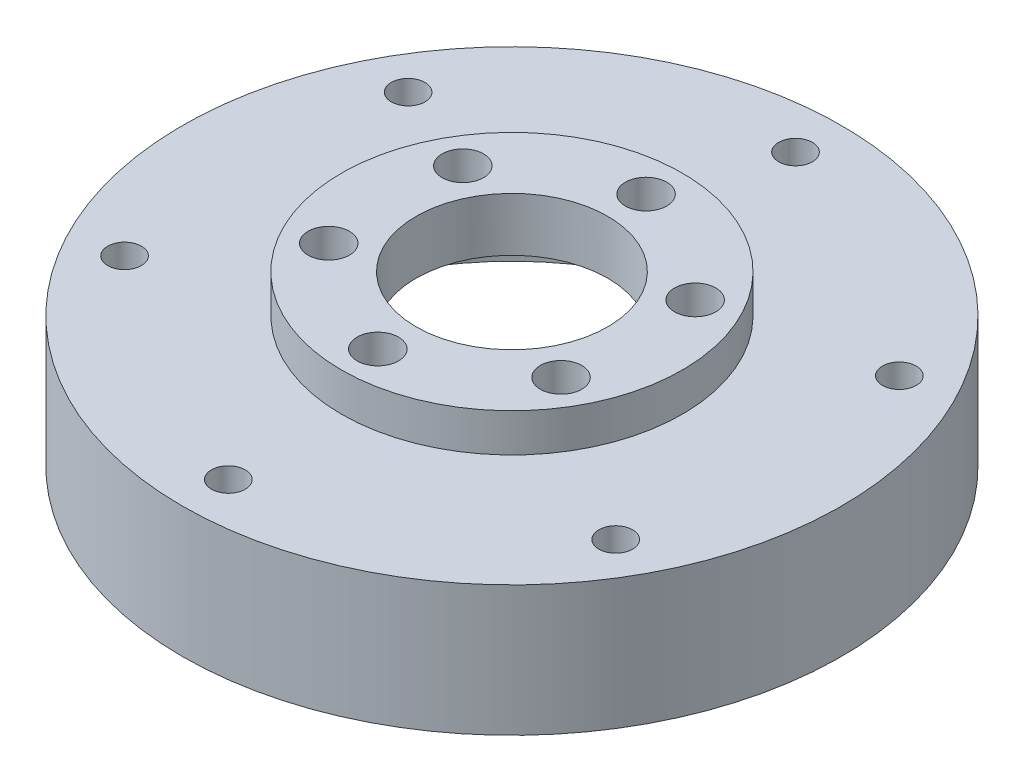
from build123d import *

# Parameters (mm, degrees)
SKETCH_22_R              = 43
EXTRUDE_5_DEPTH          = 17
SKETCH_24_R              = 22.244
EXTRUDE_6_DEPTH          = 5
SKETCH_25_R              = 32.76
CUT_EXTRUDE_9_DEPTH      = 15
SKETCH_26_R              = 12.5
CUT_EXTRUDE_10_DEPTH     = 10
SKETCH_27_R              = 2.7
CUT_EXTRUDE_11_DEPTH     = 6.1
PATTERN_CIRCULAR_6_COUNT = 6
SKETCH_29_R              = 2.2
CUT_EXTRUDE_12_DEPTH     = 64.14269554
PATTERN_CIRCULAR_7_COUNT = 6


with BuildPart() as part:
    # 스케치22 → 보스-돌출5 (new body)
    with BuildSketch(Plane(origin=(0, 0, 0), x_dir=(1, 0, 0), z_dir=(0, 1, 0))):
        Circle(SKETCH_22_R)
    extrude(amount=EXTRUDE_5_DEPTH)

    # 스케치24 → 보스-돌출6 (add)
    with BuildSketch(Plane(origin=(0, 17, 0), x_dir=(1, 0, 0), z_dir=(0, 1, 0))):
        Circle(SKETCH_24_R)
    extrude(amount=EXTRUDE_6_DEPTH)

    # 스케치25 → 컷-돌출9 (cut)
    with BuildSketch(Plane.XZ):
        Circle(SKETCH_25_R)
    extrude(amount=-CUT_EXTRUDE_9_DEPTH, mode=Mode.SUBTRACT)

    # 스케치26 → 컷-돌출10 (cut)
    with BuildSketch(Plane(origin=(0, 22, 0), x_dir=(1, 0, 0), z_dir=(0, 1, 0))):
        Circle(SKETCH_26_R)
    extrude(amount=-CUT_EXTRUDE_10_DEPTH, mode=Mode.SUBTRACT)

    # 스케치27 → 컷-돌출11 (cut)
    with BuildSketch(Plane(origin=(0, 22, 0), x_dir=(1, 0, 0), z_dir=(0, 1, 0))):
        with Locations((0, 17.5)):
            Circle(SKETCH_27_R)
    cut_extrude_11 = extrude(amount=-CUT_EXTRUDE_11_DEPTH, mode=Mode.SUBTRACT)

    # 원형 패턴6: 컷-돌출11 ×6 about axis
    pattern_circular_6_axis = Axis((0, 22, 0), (0, 1, 0))
    for i in range(1, PATTERN_CIRCULAR_6_COUNT):
        add(cut_extrude_11.rotate(pattern_circular_6_axis, i * 360 / PATTERN_CIRCULAR_6_COUNT), mode=Mode.SUBTRACT)

    # 스케치29 → 컷-돌출12 (cut, through all)
    with BuildSketch(Plane(origin=(0, 17, 0), x_dir=(1, 0, 0), z_dir=(0, 1, 0))):
        with Locations((0, 37)):
            Circle(SKETCH_29_R)
    cut_extrude_12 = extrude(amount=-CUT_EXTRUDE_12_DEPTH, mode=Mode.SUBTRACT)

    # 원형 패턴7: 컷-돌출12 ×6 about axis
    pattern_circular_7_axis = Axis((0, 22, 0), (0, 1, 0))
    for i in range(1, PATTERN_CIRCULAR_7_COUNT):
        add(cut_extrude_12.rotate(pattern_circular_7_axis, i * 360 / PATTERN_CIRCULAR_7_COUNT), mode=Mode.SUBTRACT)


solid = part.part
